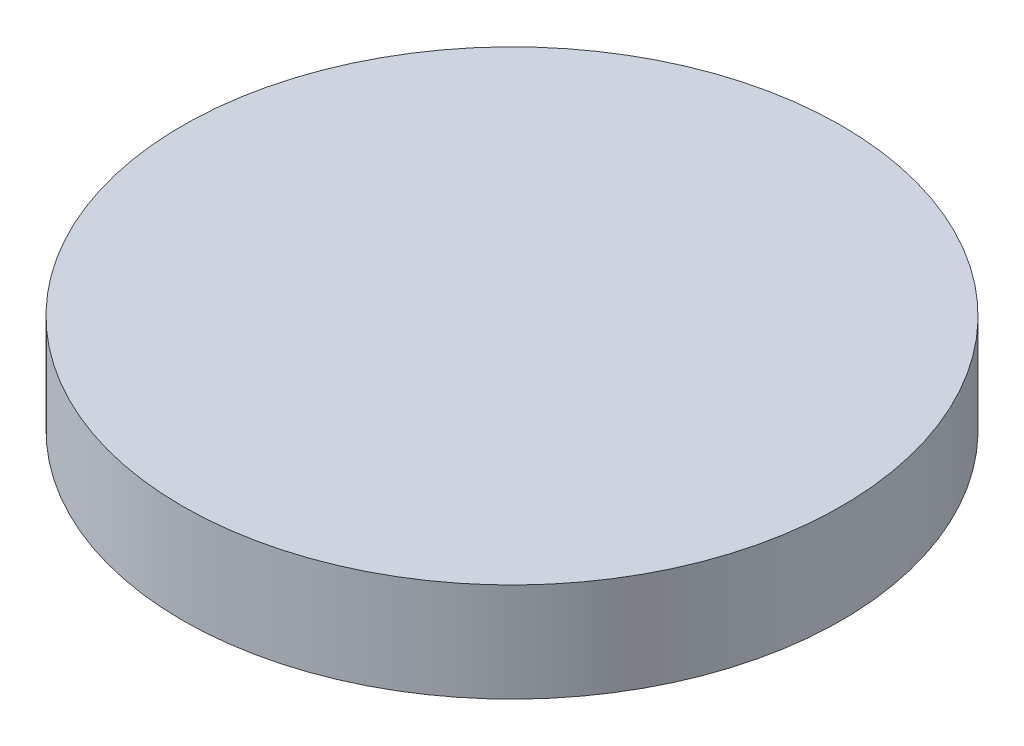
from build123d import *

# Parameters (mm, degrees)
SKETCH1_R           = 10
BOSS_EXTRUDE1_DEPTH = 3


with BuildPart() as part:
    # Sketch1 → Boss-Extrude1 (new body)
    with BuildSketch(Plane(origin=(0, 0, 0), x_dir=(1, 0, 0), z_dir=(0, 1, 0))):
        Circle(SKETCH1_R)
    extrude(amount=BOSS_EXTRUDE1_DEPTH)


solid = part.part
